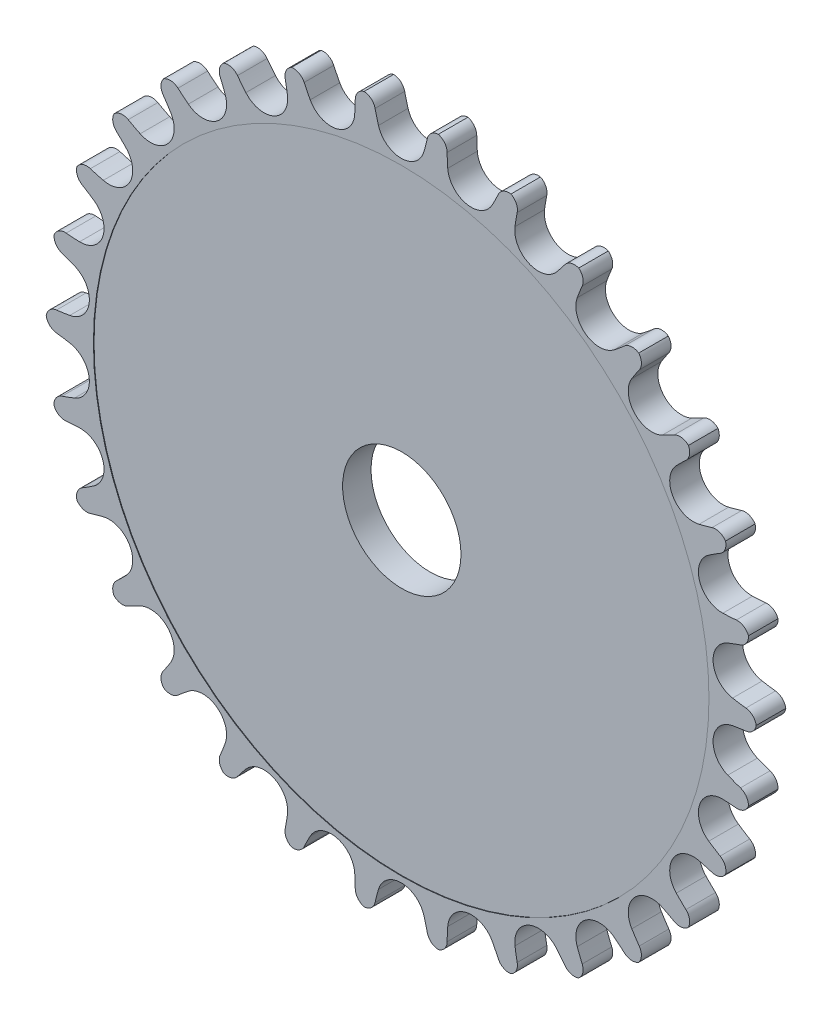
from build123d import *

# Parameters (mm, degrees)
SKETCH_1_R               = 60
EXTRUDE_1_DEPTH          = 5
CUT_EXTRUDE_1_DEPTH      = 86
CUT_EXTRUDE_1_DEPTH_BACK = 86
SKETCH_2_R               = 10
CUT_EXTRUDE_2_DEPTH      = 10
PATTERN_CIRCULAR_2_COUNT = 30
FILLET_1_R               = 2
SKETCH_6_R               = 52
CUT_EXTRUDE_3_DEPTH      = 0.1
CUT_EXTRUDE_START        = -0.1
SKETCH_7_R               = 52
CUT_EXTRUDE_5_DEPTH      = 0.1


with BuildPart() as part:
    # 草图1 → 凸台-拉伸1 (new body)
    with BuildSketch(Plane.XY):
        Circle(SKETCH_1_R)
    extrude(amount=EXTRUDE_1_DEPTH)

    # 草图2 → 切除-拉伸1 (cut, two sides: drawn at the far end of the back side and taken through both)
    with BuildSketch(Plane.XY.offset(5).offset(-CUT_EXTRUDE_1_DEPTH_BACK)):
        Circle(SKETCH_2_R)
    extrude(amount=CUT_EXTRUDE_1_DEPTH + CUT_EXTRUDE_1_DEPTH_BACK, mode=Mode.SUBTRACT)

    # 草图5 → 切除-拉伸2 (cut)
    with BuildSketch(Plane(origin=(0, 0, 0), x_dir=(-1, 0, 0), z_dir=(0, 0, -1))):
        with BuildLine():
            ThreePointArc((-3.842927057, 55.890084852), (0, 53), (3.842927057, 55.890084852))
            ThreePointArc((3.842927057, 55.890084852), (4.352942504, 57.838716971), (4.76421564, 59.810552993))
            ThreePointArc((4.76421564, 59.810552993), (0, 60), (-4.76421564, 59.810552993))
            ThreePointArc((-4.76421564, 59.810552993), (-4.352942504, 57.838716971), (-3.842927057, 55.890084852))
        make_face()
    cut_extrude_2 = extrude(amount=-CUT_EXTRUDE_2_DEPTH, mode=Mode.SUBTRACT)

    # 阵列(圆周)2: 切除-拉伸2 ×30 about axis
    pattern_circular_2_axis = Axis((0, 0, 0), (0, 0, 1))
    for i in range(1, PATTERN_CIRCULAR_2_COUNT):
        add(cut_extrude_2.rotate(pattern_circular_2_axis, i * 360 / PATTERN_CIRCULAR_2_COUNT), mode=Mode.SUBTRACT)

    # 圆角1
    # the kernel refuses this fillet: 2 mm, written as the material it takes off along each edge
    with BuildSketch(Plane(origin=(7.775207104, 59.494085038, -4.563734623), x_dir=(-0.9934246760039882, 0.11448761114797985, 0), z_dir=(0, 0, 1)), Plane(origin=(19.974815988, 56.577440082, -4.563734623), x_dir=(-0.9479126505315947, 0.31853038624622126, 0), z_dir=(0, 0, 1)), Plane(origin=(31.301429563, 51.188089506, -4.563734623), x_dir=(-0.8609722936414179, 0.508651854987118, 0), z_dir=(0, 0, 1)), Plane(origin=(41.260020466, 43.561573791, -4.563734623), x_dir=(-0.7364033161156703, 0.6765427968826835, 0), z_dir=(0, 0, 1)), Plane(origin=(49.415350486, 34.03120827, -4.563734623), x_dir=(-0.5796499800205097, 0.8148655721419471, 0), z_dir=(0, 0, 1)), Plane(origin=(55.41099257, 23.013515647, -4.563734623), x_dir=(-0.3975631583292426, 0.9175748117397717, 0), z_dir=(0, 0, 1)), Plane(origin=(59.980900665, -1.513788423, -4.563734623), x_dir=(0.010019281280214532, 0.9999498057415822, 0), z_dir=(0, 0, 1)), Plane(origin=(58.355439765, -13.951438988, -4.563734623), x_dir=(0.21770159078993942, 0.976015377628616, 0), z_dir=(0, 0, 1)), Plane(origin=(54.179566126, -25.779344723, -4.563734623), x_dir=(0.4158692961340141, 0.9094243940718765, 0), z_dir=(0, 0, 1)), Plane(origin=(47.635785466, -36.480569391, -4.563734623), x_dir=(0.5958615176747419, 0.8030872005917871, 0), z_dir=(0, 0, 1)), Plane(origin=(39.010092398, -45.587418122, -4.563734623), x_dir=(0.7498117316322915, 0.6616512428058943, 0), z_dir=(0, 0, 1)), Plane(origin=(28.679471102, -52.70187793, -4.563734623), x_dir=(0.8709915749216338, 0.49129795075446003, 0), z_dir=(0, 0, 1)), Plane(origin=(17.095419299, -57.51301278, -4.563734623), x_dir=(0.9541049069056132, 0.2994725807459359, 0), z_dir=(0, 0, 1)), Plane(origin=(4.76421564, -59.810552993, -4.563734623), x_dir=(0.995519276154522, 0.09455882192993177, 0), z_dir=(0, 0, 1)), Plane(origin=(-7.775207104, -59.494085038, -4.563734623), x_dir=(0.9934246760039882, -0.11448761114798063, 0), z_dir=(0, 0, 1)), Plane(origin=(-19.974815988, -56.577440082, -4.563734623), x_dir=(0.9479126505315963, -0.318530386246216, 0), z_dir=(0, 0, 1)), Plane(origin=(-31.301429563, -51.188089506, -4.563734623), x_dir=(0.860972293641419, -0.5086518549871161, 0), z_dir=(0, 0, 1)), Plane(origin=(-41.260020466, -43.561573791, -4.563734623), x_dir=(0.7364033161156722, -0.6765427968826816, 0), z_dir=(0, 0, 1)), Plane(origin=(-49.415350486, -34.03120827, -4.563734623), x_dir=(0.5796499800205045, -0.8148655721419508, 0), z_dir=(0, 0, 1)), Plane(origin=(-55.41099257, -23.013515647, -4.563734623), x_dir=(0.3975631583292466, -0.9175748117397701, 0), z_dir=(0, 0, 1)), Plane(origin=(-58.984908386, -10.99002196, -4.563734623), x_dir=(0.19810091889930362, -0.9801816290521117, 0), z_dir=(0, 0, 1)), Plane(origin=(-59.980900665, 1.513788423, -4.563734623), x_dir=(-0.010019281280214433, -0.9999498057415821, 0), z_dir=(0, 0, 1)), Plane(origin=(-58.355439765, 13.951438988, -4.563734623), x_dir=(-0.21770159078994314, -0.9760153776286151, 0), z_dir=(0, 0, 1)), Plane(origin=(-54.179566126, 25.779344723, -4.563734623), x_dir=(-0.41586929613401213, -0.9094243940718774, 0), z_dir=(0, 0, 1)), Plane(origin=(-47.635785466, 36.480569391, -4.563734623), x_dir=(-0.595861517674742, -0.803087200591787, 0), z_dir=(0, 0, 1)), Plane(origin=(-39.010092398, 45.587418122, -4.563734623), x_dir=(-0.7498117316322909, -0.661651242805895, 0), z_dir=(0, 0, 1)), Plane(origin=(-28.679471102, 52.70187793, -4.563734623), x_dir=(-0.8709915749216316, -0.49129795075446386, 0), z_dir=(0, 0, 1)), Plane(origin=(-17.095419299, 57.51301278, -4.563734623), x_dir=(-0.9541049069056126, -0.29947258074593774, 0), z_dir=(0, 0, 1)), Plane(origin=(-4.76421564, 59.810552993, -4.563734623), x_dir=(-0.9955192761545216, -0.09455882192993499, 0), z_dir=(0, 0, 1))) as fillet_1_piece_1:
        with BuildLine():
            CenterArc((1.795068952, 1.999768568), FILLET_1_R, 187.421912664, 83.449730066)
            ThreePointArc((-0.188174713, 1.741418868), (-0.08455436, 0.871739553), (0, 0))
            ThreePointArc((0, 0), (0.912746925, -0.00694296), (1.825493849, 0))
        make_face()
    extrude(amount=14.127469246, mode=Mode.SUBTRACT)
    with BuildSketch(Plane(origin=(17.095419299, 57.51301278, -4.563734623), x_dir=(-0.4002415612112215, -0.9164096751340004, 0), z_dir=(0, 0, 1)), Plane(origin=(28.679471102, 52.70187793, -4.563734623), x_dir=(-0.5820276078515725, -0.8131690252946039, 0), z_dir=(0, 0, 1)), Plane(origin=(39.010092398, 45.587418122, -4.563734623), x_dir=(-0.7383762551504807, -0.6743889870319297, 0), z_dir=(0, 0, 1)), Plane(origin=(47.635785466, 36.480569391, -4.563734623), x_dir=(-0.8624543169769384, -0.5061349139585638, 0), z_dir=(0, 0, 1)), Plane(origin=(54.179566126, 25.779344723, -4.563734623), x_dir=(-0.9488389866365335, -0.31576031644042307, 0), z_dir=(0, 0, 1)), Plane(origin=(58.355439765, 13.951438988, -4.563734623), x_dir=(-0.993754839545499, -0.11158547790774379, 0), z_dir=(0, 0, 1)), Plane(origin=(59.980900665, 1.513788423, -4.563734623), x_dir=(-0.9952388374015446, 0.09746618145604061, 0), z_dir=(0, 0, 1)), Plane(origin=(58.984908386, -10.99002196, -4.563734623), x_dir=(-0.9532261223773474, 0.3022581009955673, 0), z_dir=(0, 0, 1)), Plane(origin=(55.41099257, -23.013515647, -4.563734623), x_dir=(-0.869552851718835, 0.49383989112630616, 0), z_dir=(0, 0, 1)), Plane(origin=(49.415350486, -34.03120827, -4.563734623), x_dir=(-0.7478759488626906, 0.6638385083081052, 0), z_dir=(0, 0, 1)), Plane(origin=(41.260020466, -43.561573791, -4.563734623), x_dir=(-0.5935132783342825, 0.8048241972262592, 0), z_dir=(0, 0, 1)), Plane(origin=(31.301429563, -51.188089506, -4.563734623), x_dir=(-0.4132112295499775, 0.9106352067506482, 0), z_dir=(0, 0, 1)), Plane(origin=(19.974815988, -56.577440082, -4.563734623), x_dir=(-0.2148498672268644, 0.9766470880275017, 0), z_dir=(0, 0, 1)), Plane(origin=(7.775207104, -59.494085038, -4.563734623), x_dir=(-0.007098534741897454, 0.9999748050848671, 0), z_dir=(0, 0, 1)), Plane(origin=(-4.76421564, -59.810552993, -4.563734623), x_dir=(0.2009630377738432, 0.979598824748534, 0), z_dir=(0, 0, 1)), Plane(origin=(-17.095419299, -57.51301278, -4.563734623), x_dir=(0.40024156121122106, 0.9164096751340005, 0), z_dir=(0, 0, 1)), Plane(origin=(-28.679471102, -52.70187793, -4.563734623), x_dir=(0.582027607851569, 0.8131690252946063, 0), z_dir=(0, 0, 1)), Plane(origin=(-39.010092398, -45.587418122, -4.563734623), x_dir=(0.7383762551504787, 0.674388987031932, 0), z_dir=(0, 0, 1)), Plane(origin=(-47.635785466, -36.480569391, -4.563734623), x_dir=(0.8624543169769401, 0.5061349139585607, 0), z_dir=(0, 0, 1)), Plane(origin=(-54.179566126, -25.779344723, -4.563734623), x_dir=(0.9488389866365325, 0.3157603164404261, 0), z_dir=(0, 0, 1)), Plane(origin=(-58.355439765, -13.951438988, -4.563734623), x_dir=(0.9937548395454999, 0.11158547790773576, 0), z_dir=(0, 0, 1)), Plane(origin=(-59.980900665, -1.513788423, -4.563734623), x_dir=(0.9952388374015442, -0.09746618145604581, 0), z_dir=(0, 0, 1)), Plane(origin=(-58.984908386, 10.99002196, -4.563734623), x_dir=(0.9532261223773466, -0.30225810099556966, 0), z_dir=(0, 0, 1)), Plane(origin=(-55.41099257, 23.013515647, -4.563734623), x_dir=(0.8695528517188369, -0.4938398911263026, 0), z_dir=(0, 0, 1)), Plane(origin=(-49.415350486, 34.03120827, -4.563734623), x_dir=(0.7478759488626889, -0.663838508308107, 0), z_dir=(0, 0, 1)), Plane(origin=(-41.260020466, 43.561573791, -4.563734623), x_dir=(0.5935132783342804, -0.8048241972262608, 0), z_dir=(0, 0, 1)), Plane(origin=(-31.301429563, 51.188089506, -4.563734623), x_dir=(0.41321122954997047, -0.9106352067506513, 0), z_dir=(0, 0, 1)), Plane(origin=(-19.974815988, 56.577440082, -4.563734623), x_dir=(0.21484986722686308, -0.976647088027502, 0), z_dir=(0, 0, 1)), Plane(origin=(4.76421564, 59.810552993, -4.563734623), x_dir=(-0.20096303777384397, -0.9795988247485338, 0), z_dir=(0, 0, 1))) as fillet_1_piece_2:
        with BuildLine():
            CenterArc((1.795345185, 1.999520575), FILLET_1_R, 185.295709909, 83.449730066)
            ThreePointArc((-0.196118038, 1.814928513), (-0.104961795, 0.906718355), (0, 0))
            ThreePointArc((0, 0), (0.875778139, 0.009588491), (1.751556279, 0))
        make_face()
    extrude(amount=14.127469246, mode=Mode.SUBTRACT)
    with BuildSketch(Plane(origin=(58.984908386, 10.99002196, -4.563734623), x_dir=(-0.9532261223773466, -0.30225810099556966, 0), z_dir=(0, 0, 1))) as fillet_1_piece_3:
        with BuildLine():
            CenterArc((1.795345185, -1.999520575), FILLET_1_R, 91.254560025, 83.449730066)
            ThreePointArc((-0.196118038, -1.814928513), (-0.104961795, -0.906718355), (0, 0))
            ThreePointArc((0, 0), (0.875778139, -0.009588491), (1.751556279, 0))
        make_face()
    extrude(amount=14.127469246, mode=Mode.SUBTRACT)
    with BuildSketch(Plane(origin=(-7.775207104, 59.494085038, -4.563734623), x_dir=(0.9934246760039882, 0.11448761114797985, 0), z_dir=(0, 0, 1))) as fillet_1_piece_4:
        with BuildLine():
            CenterArc((1.795068952, -1.999768568), FILLET_1_R, 89.12835727, 83.449730066)
            ThreePointArc((-0.188174713, -1.741418868), (-0.08455436, -0.871739553), (0, 0))
            ThreePointArc((0, 0), (0.912746925, 0.00694296), (1.825493849, 0))
        make_face()
    extrude(amount=14.127469246, mode=Mode.SUBTRACT)

    # 草图6 → 切除-拉伸3 (cut)
    with BuildSketch(Plane(origin=(0, 0, 0), x_dir=(-1, 0, 0), z_dir=(0, 0, -1))):
        Circle(SKETCH_6_R)
    extrude(amount=-CUT_EXTRUDE_3_DEPTH, mode=Mode.SUBTRACT)

    # 草图7 → 切除-拉伸5 (cut)
    with BuildSketch(Plane.XY.offset(5).offset(CUT_EXTRUDE_START)):
        with Locations(Location((0, 0, 0), (0, 0, 180))):
            Circle(SKETCH_7_R)
    extrude(amount=CUT_EXTRUDE_5_DEPTH, mode=Mode.SUBTRACT)


solid = part.part
